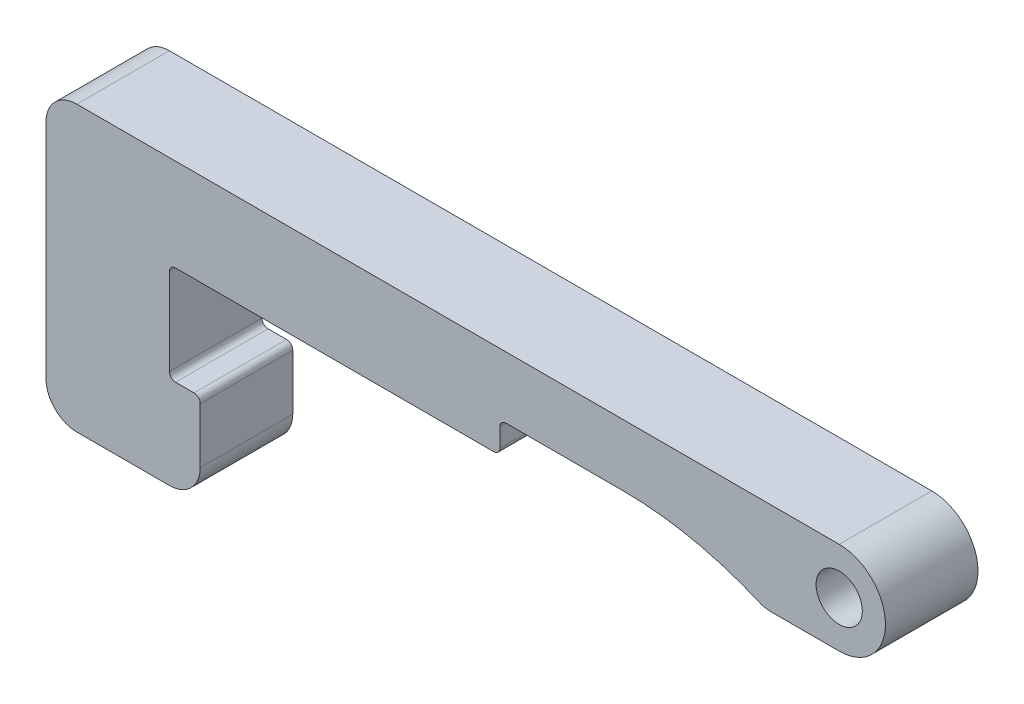
from build123d import *

# Parameters (mm, degrees)
SKETCH1_R           = 7.5
BOSS_EXTRUDE1_DEPTH = 30
FILLET1_R           = 10
FILLET2_R           = 2


with BuildPart() as part:
    # Sketch1 → Boss-Extrude1 (new body)
    with BuildSketch(Plane.XY):
        with BuildLine():
            Line((50, 0), (0, 0))
            Line((0, 0), (0, 92.063011964))
            Line((0, 92.063011964), (257.15595299, 92.063011964))
            ThreePointArc((257.15595299, 92.063011964), (272.15595299, 77.063011964), (257.15595299, 62.063011964))
            Line((257.15595299, 62.063011964), (232.96640638, 62.063011964))
            ThreePointArc((232.96640638, 62.063011964), (210.371269288, 69.534467833), (186.707598025, 72.063011964))
            Line((186.707598025, 72.063011964), (147.16248319, 72.063011964))
            Line((147.16248319, 72.063011964), (147.16248319, 62.063011964))
            Line((147.16248319, 62.063011964), (40, 62.063011964))
            Line((40, 62.063011964), (40, 30))
            Line((40, 30), (50, 30))
            Line((50, 30), (50, 0))
        make_face()
        with Locations((257.15595299, 77.063011964)):
            Circle(SKETCH1_R, mode=Mode.SUBTRACT)
    extrude(amount=BOSS_EXTRUDE1_DEPTH)

    # Fillet1
    fillet1_edges = [part.edges().sort_by_distance(p)[0] for p in [
        (232.96640638, 62.063011964, 15),
        (0, 92.063011964, 15),
        (50, 0, 15),
        (0, 0, 15),
    ]]
    fillet(fillet1_edges, radius=FILLET1_R)

    # Fillet2
    fillet2_edges = [part.edges().sort_by_distance(p)[0] for p in [
        (147.16248319, 72.063011964, 15),
        (147.16248319, 62.063011964, 15),
        (40, 62.063011964, 15),
        (40, 30, 15),
        (50, 30, 15),
    ]]
    fillet(fillet2_edges, radius=FILLET2_R)


solid = part.part
